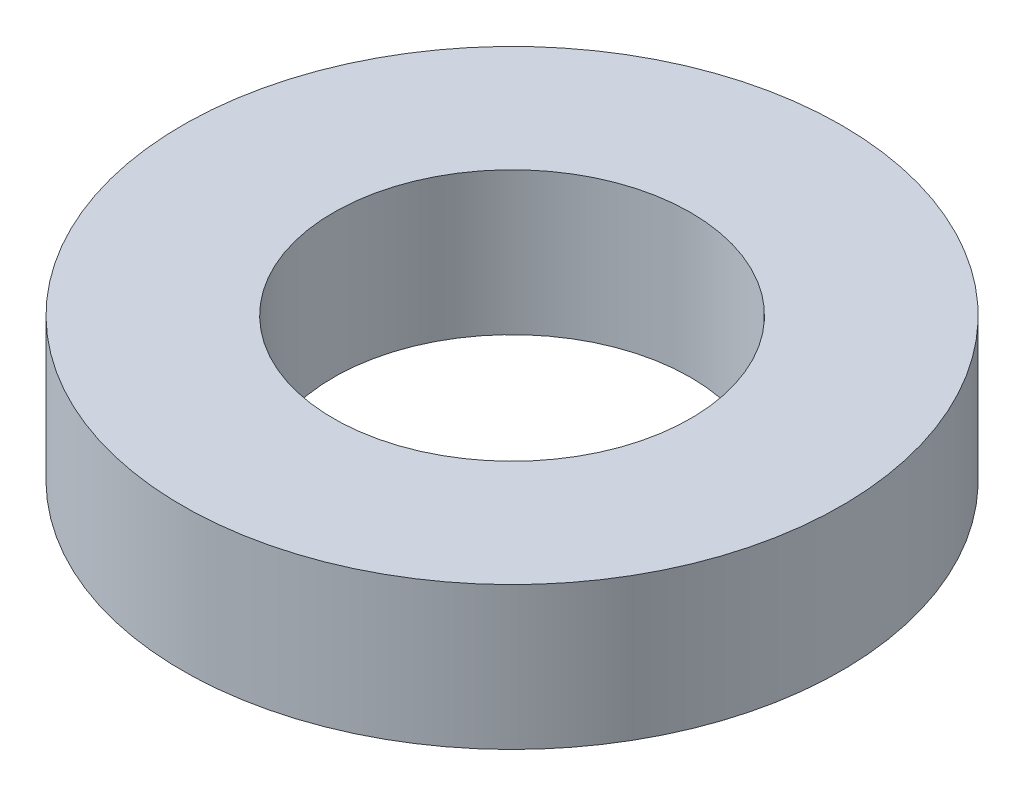
from build123d import *

# Parameters (mm, degrees)
SKETCH1_R           = 60
BOSS_EXTRUDE1_DEPTH = 26
SKETCH2_R           = 32.5
CUT_EXTRUDE1_DEPTH  = 89.746830929


with BuildPart() as part:
    # Sketch1 → Boss-Extrude1 (new body)
    with BuildSketch(Plane(origin=(0, 0, 0), x_dir=(1, 0, 0), z_dir=(0, 1, 0))):
        Circle(SKETCH1_R)
    extrude(amount=BOSS_EXTRUDE1_DEPTH)

    # Sketch2 → Cut-Extrude1 (cut, through all)
    with BuildSketch(Plane(origin=(0, 0, 0), x_dir=(1, 0, 0), z_dir=(0, 1, 0))):
        Circle(SKETCH2_R)
    extrude(amount=CUT_EXTRUDE1_DEPTH, mode=Mode.SUBTRACT)


solid = part.part
